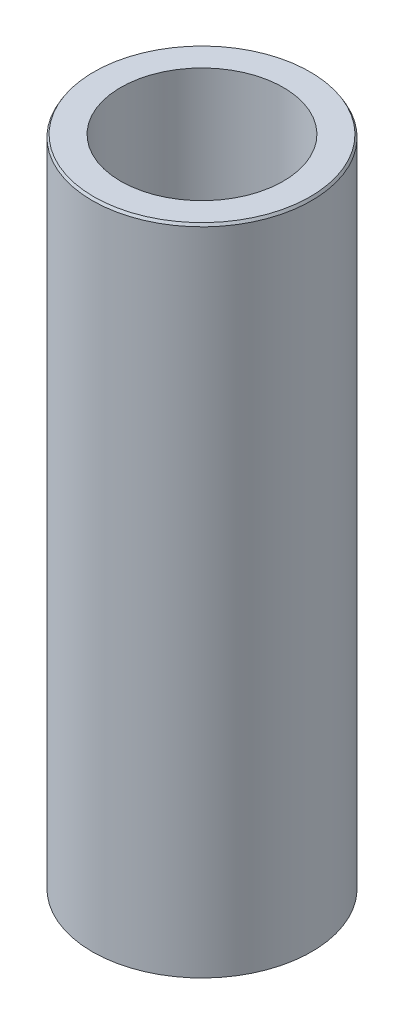
from build123d import *
from OCP.BRepFilletAPI import BRepFilletAPI_MakeChamfer

# Parameters (mm, degrees)
SKETCH1_R           = 40
BOSS_EXTRUDE1_DEPTH = 238.74899406
SKETCH2_R           = 29.651695758
CUT_EXTRUDE1_DEPTH  = 246.359088205
CHAMFER1_SIZE       = 0.947132745
CHAMFER1_SIZE2      = 0.546827345


with BuildPart() as part:
    # Sketch1 → Boss-Extrude1 (new body)
    with BuildSketch(Plane(origin=(0, 0, 0), x_dir=(1, 0, 0), z_dir=(0, 1, 0))):
        Circle(SKETCH1_R)
    extrude(amount=BOSS_EXTRUDE1_DEPTH)

    # Sketch2 → Cut-Extrude1 (cut, through all)
    with BuildSketch(Plane(origin=(0, 0, 0), x_dir=(1, 0, 0), z_dir=(0, 1, 0))):
        Circle(SKETCH2_R)
    extrude(amount=CUT_EXTRUDE1_DEPTH, mode=Mode.SUBTRACT)

    # Chamfer1: one chamfer whose edges measure the first distance from different faces: ONE call of the kernel's chamfer builder (chamfer() names one face for all edges)
    chamfer1_edges_1 = [part.edges().sort_by_distance(p)[0] for p in [
        (-40, 238.74899406, 0),
    ]]
    chamfer1_side_1 = [part.faces().sort_by_distance(p)[0] for p in [
        (-40, 119.37449703, 0),
    ]]
    chamfer1_edges_2 = [part.edges().sort_by_distance(p)[0] for p in [
        (-40, 0, 0),
    ]]
    chamfer1_side_2 = [part.faces().sort_by_distance(p)[0] for p in [
        (-38.86862915, 0, 0),
    ]]
    chamfer1 = BRepFilletAPI_MakeChamfer(part.part.solid().wrapped)
    for e in chamfer1_edges_1:
        chamfer1.Add(CHAMFER1_SIZE, CHAMFER1_SIZE2, e.wrapped, chamfer1_side_1[0].wrapped)  # the first distance lies on this face
    for e in chamfer1_edges_2:
        chamfer1.Add(CHAMFER1_SIZE, CHAMFER1_SIZE2, e.wrapped, chamfer1_side_2[0].wrapped)  # the first distance lies on this face
    add(Compound.cast(chamfer1.Shape()), mode=Mode.REPLACE)


solid = part.part
